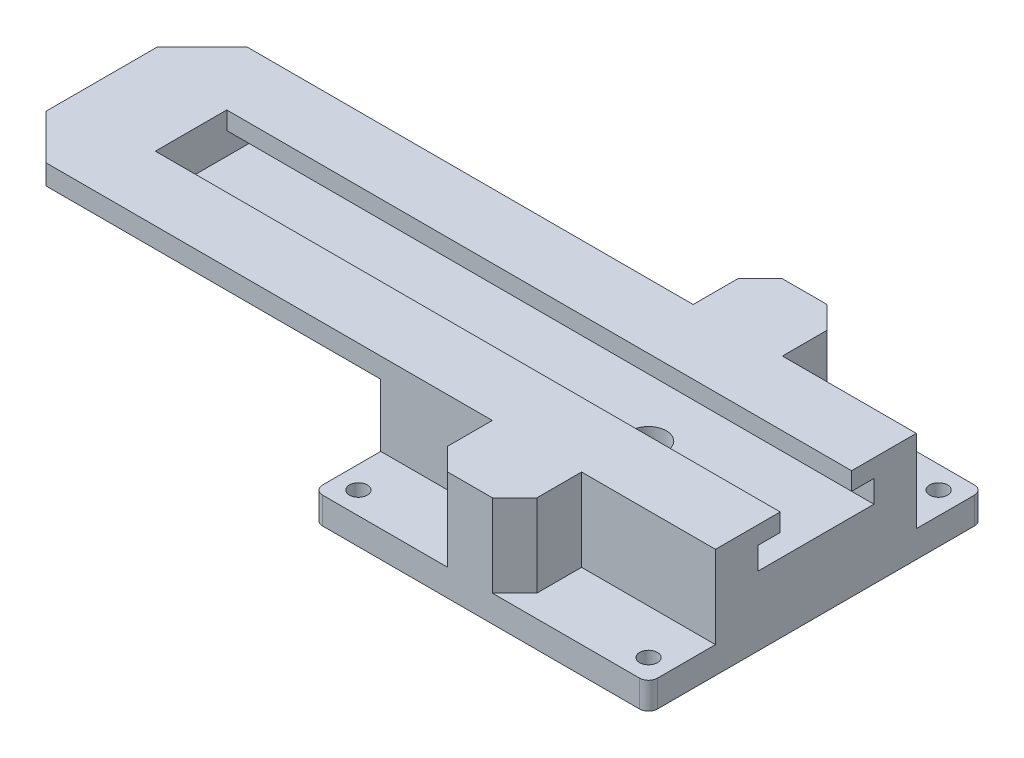
from build123d import *

# Parameters (mm, degrees)
BOSS_EXTRUDE1_DEPTH = 4
BOSS_EXTRUDE2_DEPTH = 5
BOSS_EXTRUDE3_START = -5
SKETCH3_W           = 160
SKETCH3_H           = 75
BOSS_EXTRUDE3_DEPTH = 5.5
BOSS_EXTRUDE4_START = -10.5
BOSS_EXTRUDE4_DEPTH = 10
BOSS_EXTRUDE7_START = -20.5
SKETCH17_R          = 15
BOSS_EXTRUDE7_DEPTH = 8
CUT_EXTRUDE1_START  = -25
SKETCH5_R           = 10.5
CUT_EXTRUDE1_DEPTH  = 12
CUT_EXTRUDE2_START  = -4
SKETCH7_R           = 1.5
CUT_EXTRUDE2_DEPTH  = 25
CUT_EXTRUDE3_START  = -5
SKETCH8_R           = 4
CUT_EXTRUDE3_DEPTH  = 18.5
CUT_EXTRUDE5_START  = 4
SKETCH18_W          = 110
SKETCH18_H          = 15
SKETCH18_W_2        = 30
CUT_EXTRUDE5_DEPTH  = 18.5
CUT_EXTRUDE6_START  = 4
SKETCH9_R           = 2
CUT_EXTRUDE6_DEPTH  = 40
CHAMFER1_SIZE       = 10
FILLET1_R           = 2
CHAMFER2_SIZE       = 5


with BuildPart() as part:
    # Sketch1 → Boss-Extrude1 (new body)
    with BuildSketch(Plane(origin=(0, 0, 0), x_dir=(1, 0, 0), z_dir=(0, 1, 0))):
        Polygon((80, -16), (220, -16), (220, -45.5), (60, -45.5), (60, 29.5), (220, 29.5), (220, 0), (80, 0), align=None)
    extrude(amount=BOSS_EXTRUDE1_DEPTH)

    # Sketch2 → Boss-Extrude2 (add)
    with BuildSketch(Plane(origin=(0, 0, 0), x_dir=(1, 0, 0), z_dir=(0, 1, 0))):
        Polygon((220, 5), (220, 29.5), (60, 29.5), (60, -45.5), (220, -45.5), (220, -21), (80, -21), (80, 5), align=None)
    extrude(amount=-BOSS_EXTRUDE2_DEPTH)

    # Sketch3 → Boss-Extrude3 (add)
    with BuildSketch(Plane(origin=(0, 0, 0), x_dir=(1, 0, 0), z_dir=(0, 1, 0)).offset(BOSS_EXTRUDE3_START)):
        with Locations((140, -8)):
            Rectangle(SKETCH3_W, SKETCH3_H)
    extrude(amount=-BOSS_EXTRUDE3_DEPTH)

    # Sketch4 → Boss-Extrude4 (add)
    with BuildSketch(Plane(origin=(0, 0, 0), x_dir=(1, 0, 0), z_dir=(0, 1, 0)).offset(BOSS_EXTRUDE4_START)):
        Polygon((145, -8), (145, -45.5), (220, -45.5), (220, 29.5), (145, 29.5), align=None)
    extrude(amount=-BOSS_EXTRUDE4_DEPTH)

    # Sketch17 → Boss-Extrude7 (add)
    with BuildSketch(Plane(origin=(0, 0, 0), x_dir=(1, 0, 0), z_dir=(0, 1, 0)).offset(BOSS_EXTRUDE7_START)):
        with Locations((182.5, -8)):
            Circle(SKETCH17_R)
    extrude(amount=-BOSS_EXTRUDE7_DEPTH)

    # Sketch5 → Cut-Extrude1 (cut)
    with BuildSketch(Plane(origin=(0, 0, 0), x_dir=(1, 0, 0), z_dir=(0, 1, 0)).offset(CUT_EXTRUDE1_START)):
        with Locations((182.5, -8)):
            Circle(SKETCH5_R)
    extrude(amount=-CUT_EXTRUDE1_DEPTH, mode=Mode.SUBTRACT)

    # Sketch7 → Cut-Extrude2 (cut)
    with BuildSketch(Plane(origin=(0, 0, 0), x_dir=(1, 0, 0), z_dir=(0, 1, 0)).offset(CUT_EXTRUDE2_START)):
        with Locations((182.5, -8)):
            Circle(SKETCH7_R)
    extrude(amount=-CUT_EXTRUDE2_DEPTH, mode=Mode.SUBTRACT)

    # Sketch8 → Cut-Extrude3 (cut)
    with BuildSketch(Plane(origin=(0, 0, 0), x_dir=(1, 0, 0), z_dir=(0, 1, 0)).offset(CUT_EXTRUDE3_START)):
        with Locations((182.5, -8)):
            Circle(SKETCH8_R)
    extrude(amount=-CUT_EXTRUDE3_DEPTH, mode=Mode.SUBTRACT)

    # Sketch18 → Cut-Extrude5 (cut)
    with BuildSketch(Plane(origin=(0, 0, 0), x_dir=(1, 0, 0), z_dir=(0, 1, 0)).offset(CUT_EXTRUDE5_START)):
        with Locations((115, 22)):
            Rectangle(SKETCH18_W, SKETCH18_H)
        with Locations((115, -38)):
            Rectangle(SKETCH18_W, SKETCH18_H)
        with Locations((205, 22)):
            Rectangle(SKETCH18_W_2, SKETCH18_H)
        with Locations((205, -38)):
            Rectangle(SKETCH18_W_2, SKETCH18_H)
    extrude(amount=-CUT_EXTRUDE5_DEPTH, mode=Mode.SUBTRACT)

    # Sketch9 → Cut-Extrude6 (cut)
    with BuildSketch(Plane(origin=(0, 0, 0), x_dir=(1, 0, 0), z_dir=(0, 1, 0)).offset(CUT_EXTRUDE6_START)):
        with Locations((150, -40.5)):
            Circle(SKETCH9_R)
        with Locations((150, 24.5)):
            Circle(SKETCH9_R)
        with Locations((215, 24.5)):
            Circle(SKETCH9_R)
        with Locations((215, -40.5)):
            Circle(SKETCH9_R)
    extrude(amount=-CUT_EXTRUDE6_DEPTH, mode=Mode.SUBTRACT)

    # Chamfer1
    chamfer1_edges = [part.edges().sort_by_distance(p)[0] for p in [
        (102.5, -10.5, 30.5),
        (60, -3.25, 30.5),
        (60, -10.5, 8),
        (60, -3.25, -14.5),
        (102.5, -10.5, -14.5),
    ]]
    chamfer(chamfer1_edges, length=CHAMFER1_SIZE)

    # Fillet1
    fillet1_edges = [part.edges().sort_by_distance(p)[0] for p in [
        (220, -17.5, 45.5),
        (145, -17.5, 45.5),
        (220, -17.5, -29.5),
        (145, -17.5, -29.5),
    ]]
    fillet(fillet1_edges, radius=FILLET1_R)

    # Chamfer2
    chamfer2_edges = [part.edges().sort_by_distance(p)[0] for p in [
        (190, -5.25, 45.5),
        (170, -5.25, 45.5),
        (170, -5.25, -29.5),
        (190, -5.25, -29.5),
    ]]
    chamfer(chamfer2_edges, length=CHAMFER2_SIZE)


solid = part.part
